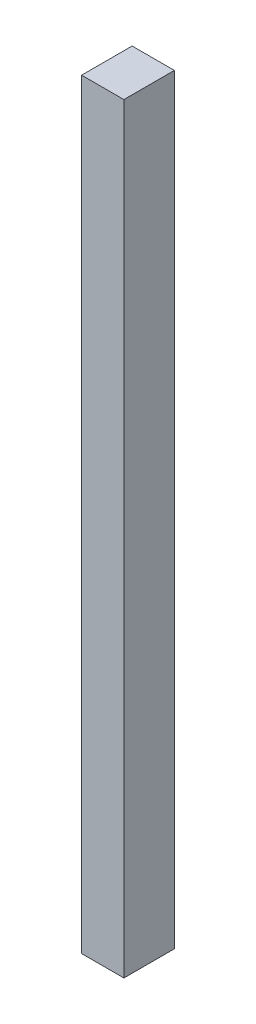
from build123d import *

# Parameters (mm, degrees)
SKETCH1_W           = 25.4
SKETCH1_H           = 30.352254963
BOSS_EXTRUDE1_DEPTH = 457.2


with BuildPart() as part:
    # Sketch1 → Boss-Extrude1 (new body)
    with BuildSketch(Plane(origin=(0, 0, 0), x_dir=(1, 0, 0), z_dir=(0, 1, 0))):
        with Locations((12.7, 15.176127482)):
            Rectangle(SKETCH1_W, SKETCH1_H)
    extrude(amount=BOSS_EXTRUDE1_DEPTH)


solid = part.part
